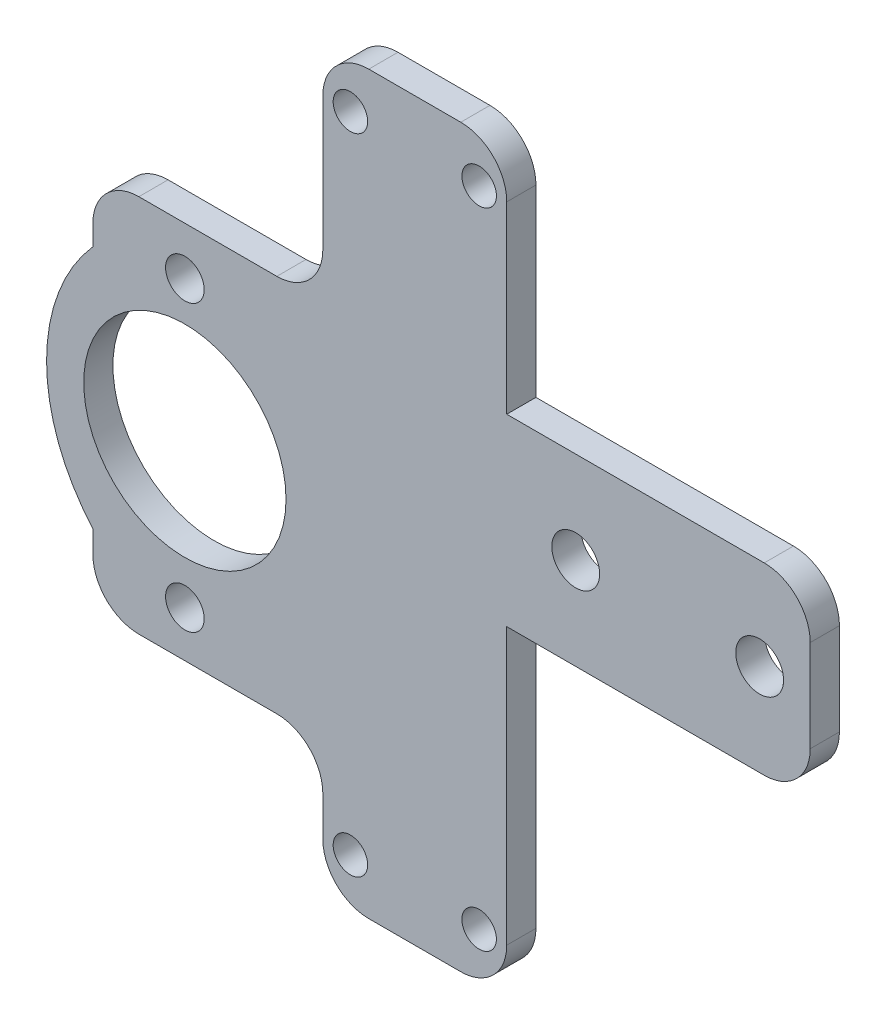
from build123d import *

# Parameters (mm, degrees)
BASE_FLANGE1_DEPTH         = 3.175
M3_5_CLEARANCE_HOLE1_D     = 3.75
F_5_2_5_2_DIAMETER_HOLE1_D = 5.2
F_4_2_4_2_DIAMETER_HOLE1_D = 4.2
F_22_0_22_DIAMETER_HOLE1_D = 22


# Sheet-metal steps are written as plain solids
with BuildPart() as part:
    # Sketch11 → Base-Flange1 (new body)
    with BuildSketch(Plane(origin=(0, 0, 0), x_dir=(-1, 0, 0), z_dir=(0, 0, -1))):
        with BuildLine():
            Line((20, 55.487), (5, 55.487))
            ThreePointArc((5, 55.487), (1.464466094, 56.951466094), (0, 60.487))
            Line((0, 60.487), (0, 75))
            ThreePointArc((0, 75), (-1.464466094, 78.535533906), (-5, 80))
            Line((-5, 80), (-15, 80))
            ThreePointArc((-15, 80), (-18.535533906, 78.535533906), (-20, 75))
            Line((-20, 75), (-20, 55))
            Line((-20, 55), (-48, 55))
            ThreePointArc((-48, 55), (-51.535533906, 53.535533906), (-53, 50))
            Line((-53, 50), (-53, 40))
            ThreePointArc((-53, 40), (-51.535533906, 36.464466094), (-48, 35))
            Line((-48, 35), (-20, 35))
            Line((-20, 35), (-20, 5))
            ThreePointArc((-20, 5), (-18.535533906, 1.464466094), (-15, 0))
            Line((-15, 0), (-5, 0))
            ThreePointArc((-5, 0), (-1.464466094, 1.464466094), (0, 5))
            Line((0, 5), (0, 9.287))
            ThreePointArc((0, 9.287), (1.464466094, 12.822533906), (5, 14.287))
            Line((5, 14.287), (20, 14.287))
            ThreePointArc((20, 14.287), (23.535533906, 15.751466094), (25, 19.287))
            Line((25, 19.287), (25, 21.728499788))
            ThreePointArc((25, 21.728499788), (30.037804903, 35), (25, 48.271500212))
            Line((25, 48.271500212), (25, 50.487))
            ThreePointArc((25, 50.487), (23.535533906, 54.022533906), (20, 55.487))
        make_face()
    extrude(amount=-BASE_FLANGE1_DEPTH)

    # M3.5 Clearance Hole1 (through all)
    with Locations(Plane.XY.offset(3.175)):
        with Locations((17, 5), (3, 75), (3, 5), (17, 75)):
            Hole(M3_5_CLEARANCE_HOLE1_D / 2)

    # Ø5.2 (5.2) Diameter Hole1 (through all)
    with Locations(Plane.XY.offset(3.175)):
        with Locations((27.5, 45), (47.5, 45)):
            Hole(F_5_2_5_2_DIAMETER_HOLE1_D / 2)

    # Ø4.2 (4.2) Diameter Hole1 (through all)
    with Locations(Plane.XY.offset(3.175)):
        with Locations((-15, 19.287), (-15, 50.275)):
            Hole(F_4_2_4_2_DIAMETER_HOLE1_D / 2)

    # Ø22.0 (22) Diameter Hole1 (through all)
    with Locations(Plane.XY.offset(3.175)):
        with Locations((-15, 35)):
            Hole(F_22_0_22_DIAMETER_HOLE1_D / 2)


solid = part.part
